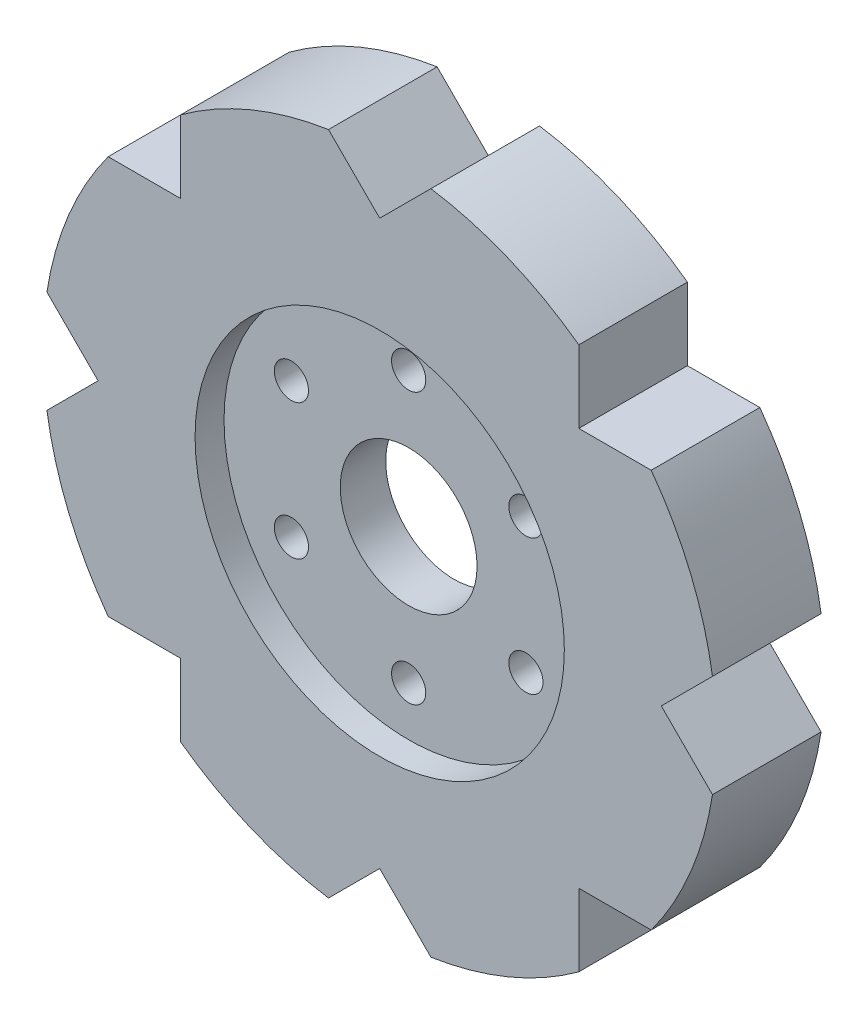
from build123d import *

# Parameters (mm, degrees)
BOSS_EXTRUDE1_DEPTH   = 19.05
SKETCH2_R             = 12
CUT_EXTRUDE1_DEPTH    = 85.714807147
SKETCH3_R             = 32.385
CUT_EXTRUDE2_DEPTH    = 5.08
SKETCH4_R             = 28.4
CUT_EXTRUDE3_DEPTH    = 6
F_6_0MM_DOWEL_HOLE1_D = 6


with BuildPart() as part:
    # Sketch1 → Boss-Extrude1 (new body)
    with BuildSketch(Plane.XY):
        with BuildLine():
            Line((-8.980256121, 58.36821074), (0, 49.387954619))
            Line((0, 49.387954619), (8.980256121, 58.36821074))
            ThreePointArc((8.980256121, 58.36821074), (22.599370098, 54.559705792), (34.92255762, 47.62255762))
            Line((34.92255762, 47.62255762), (34.92255762, 34.92255762))
            Line((34.92255762, 34.92255762), (47.62255762, 34.92255762))
            ThreePointArc((47.62255762, 34.92255762), (54.559705792, 22.599370098), (58.36821074, 8.980256121))
            Line((58.36821074, 8.980256121), (49.387954619, 0))
            Line((49.387954619, 0), (58.36821074, -8.980256121))
            ThreePointArc((58.36821074, -8.980256121), (54.559705792, -22.599370098), (47.62255762, -34.92255762))
            Line((47.62255762, -34.92255762), (34.92255762, -34.92255762))
            Line((34.92255762, -34.92255762), (34.92255762, -47.62255762))
            ThreePointArc((34.92255762, -47.62255762), (22.599370098, -54.559705792), (8.980256121, -58.36821074))
            Line((8.980256121, -58.36821074), (0, -49.387954619))
            Line((0, -49.387954619), (-8.980256121, -58.36821074))
            ThreePointArc((-8.980256121, -58.36821074), (-22.599370098, -54.559705792), (-34.92255762, -47.62255762))
            Line((-34.92255762, -47.62255762), (-34.92255762, -34.92255762))
            Line((-34.92255762, -34.92255762), (-47.62255762, -34.92255762))
            ThreePointArc((-47.62255762, -34.92255762), (-54.559705792, -22.599370098), (-58.36821074, -8.980256121))
            Line((-58.36821074, -8.980256121), (-49.387954619, 0))
            Line((-49.387954619, 0), (-58.36821074, 8.980256121))
            ThreePointArc((-58.36821074, 8.980256121), (-54.559705792, 22.599370098), (-47.62255762, 34.92255762))
            Line((-47.62255762, 34.92255762), (-34.92255762, 34.92255762))
            Line((-34.92255762, 34.92255762), (-34.92255762, 47.62255762))
            ThreePointArc((-34.92255762, 47.62255762), (-22.599370098, 54.559705792), (-8.980256121, 58.36821074))
        make_face()
    extrude(amount=BOSS_EXTRUDE1_DEPTH)

    # Sketch2 → Cut-Extrude1 (cut, through all)
    with BuildSketch(Plane.XY.offset(19.05)):
        Circle(SKETCH2_R)
    extrude(amount=-CUT_EXTRUDE1_DEPTH, mode=Mode.SUBTRACT)

    # Sketch3 → Cut-Extrude2 (cut)
    with BuildSketch(Plane.XY.offset(19.05)):
        Circle(SKETCH3_R)
    extrude(amount=-CUT_EXTRUDE2_DEPTH, mode=Mode.SUBTRACT)

    # Sketch4 → Cut-Extrude3 (cut)
    with BuildSketch(Plane(origin=(0, 0, 0), x_dir=(-1, 0, 0), z_dir=(0, 0, -1))):
        Circle(SKETCH4_R)
    extrude(amount=-CUT_EXTRUDE3_DEPTH, mode=Mode.SUBTRACT)

    # Ø6.0mm Dowel Hole1 (through all)
    with Locations(Plane(origin=(0, 0, 6), x_dir=(-1, 0, 0), z_dir=(0, 0, -1))):
        with Locations((0, 23.75), (20.56810334, 11.875), (20.56810334, -11.875), (0, -23.75), (-20.56810334, 11.875), (-20.56810334, -11.875)):
            Hole(F_6_0MM_DOWEL_HOLE1_D / 2)


solid = part.part
